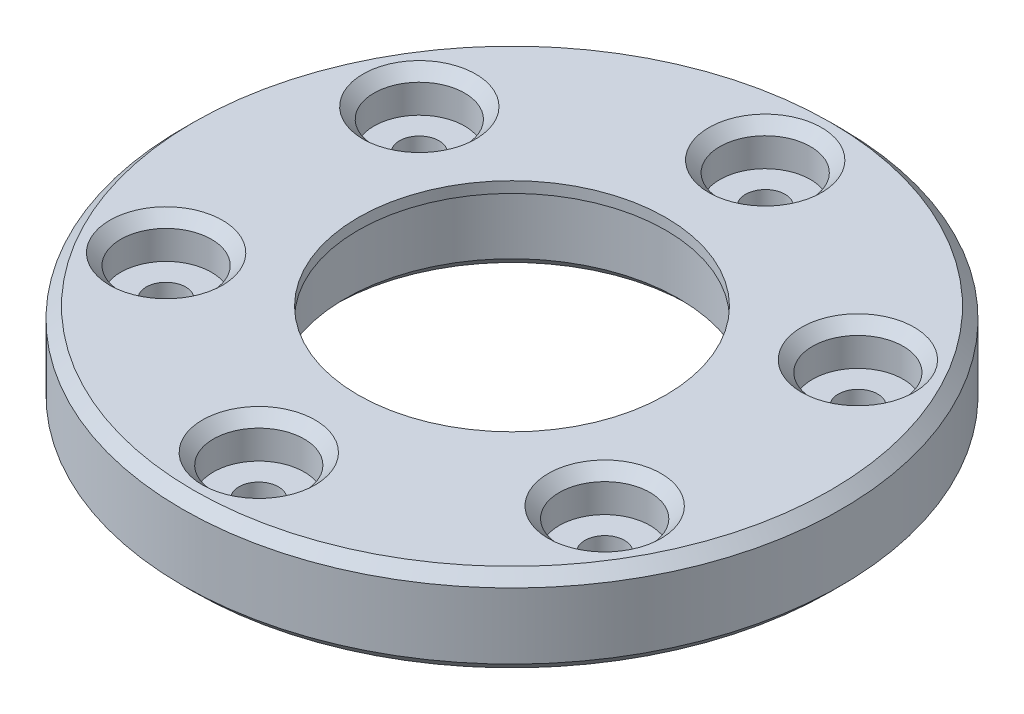
from build123d import *

# Parameters (mm, degrees)
SKETCH_1_R          = 15
SKETCH_1_R_2        = 7
SKETCH_1_R_3        = 2.065
EXTRUDE_1_DEPTH     = 1.8
EXTRUDE_START       = 2.2
SKETCH_2_R          = 15
SKETCH_2_R_2        = 7
SKETCH_2_R_3        = 0.9
EXTRUDE_2_DEPTH     = 2.2
SKETCH_3_R          = 7.6
CUT_EXTRUDE_1_DEPTH = 3.5
CHAMFER_1_SIZE      = 0.5


with BuildPart() as part:
    # 草图1 → 凸台-拉伸1 (new body)
    with BuildSketch(Plane(origin=(0, 0, 0), x_dir=(1, 0, 0), z_dir=(0, 1, 0))):
        Circle(SKETCH_1_R)
        Circle(SKETCH_1_R_2, mode=Mode.SUBTRACT)
        with Locations((0, 11.525)):
            Circle(SKETCH_1_R_3, mode=Mode.SUBTRACT)
        with Locations((9.980942779, 5.7625)):
            Circle(SKETCH_1_R_3, mode=Mode.SUBTRACT)
        with Locations((9.980942779, -5.7625)):
            Circle(SKETCH_1_R_3, mode=Mode.SUBTRACT)
        with Locations((0, -11.525)):
            Circle(SKETCH_1_R_3, mode=Mode.SUBTRACT)
        with Locations((-9.980942779, -5.7625)):
            Circle(SKETCH_1_R_3, mode=Mode.SUBTRACT)
        with Locations((-9.980942779, 5.7625)):
            Circle(SKETCH_1_R_3, mode=Mode.SUBTRACT)
    extrude(amount=EXTRUDE_1_DEPTH)

    # 草图2 → 凸台-拉伸2 (add)
    with BuildSketch(Plane(origin=(0, 0, 0), x_dir=(-1, 0, 0), z_dir=(0, -1, 0)).offset(EXTRUDE_START)):
        Circle(SKETCH_2_R)
        Circle(SKETCH_2_R_2, mode=Mode.SUBTRACT)
        with Locations((0, 11.53)):
            Circle(SKETCH_2_R_3, mode=Mode.SUBTRACT)
        with Locations((9.985272906, 5.765)):
            Circle(SKETCH_2_R_3, mode=Mode.SUBTRACT)
        with Locations((9.985272906, -5.765)):
            Circle(SKETCH_2_R_3, mode=Mode.SUBTRACT)
        with Locations((0, -11.53)):
            Circle(SKETCH_2_R_3, mode=Mode.SUBTRACT)
        with Locations((-9.985272906, -5.765)):
            Circle(SKETCH_2_R_3, mode=Mode.SUBTRACT)
        with Locations((-9.985272906, 5.765)):
            Circle(SKETCH_2_R_3, mode=Mode.SUBTRACT)
    extrude(amount=-EXTRUDE_2_DEPTH)

    # 草图3 → 切除-拉伸1 (cut)
    with BuildSketch(Plane(origin=(0, -2.2, 0), x_dir=(-1, 0, 0), z_dir=(0, -1, 0))):
        Circle(SKETCH_3_R)
    extrude(amount=-CUT_EXTRUDE_1_DEPTH, mode=Mode.SUBTRACT)

    # 倒角1
    chamfer_1_edges = [part.edges().sort_by_distance(p)[0] for p in [
        (15, -2.2, 0),
        (-12.045942779, 1.8, -5.7625),
        (-2.065, 1.8, 11.525),
        (7.915942779, 1.8, -5.7625),
        (-15, 1.8, 0),
        (-2.065, 1.8, -11.525),
        (7.915942779, 1.8, 5.7625),
        (-12.045942779, 1.8, 5.7625),
        (10.885272906, -2.2, -5.765),
        (0.9, -2.2, 11.53),
        (-9.085272906, -2.2, -5.765),
        (0.9, -2.2, -11.53),
        (-9.085272906, -2.2, 5.765),
        (10.885272906, -2.2, 5.765),
        (7.6, -2.2, 0),
    ]]
    chamfer(chamfer_1_edges, length=CHAMFER_1_SIZE)


solid = part.part
